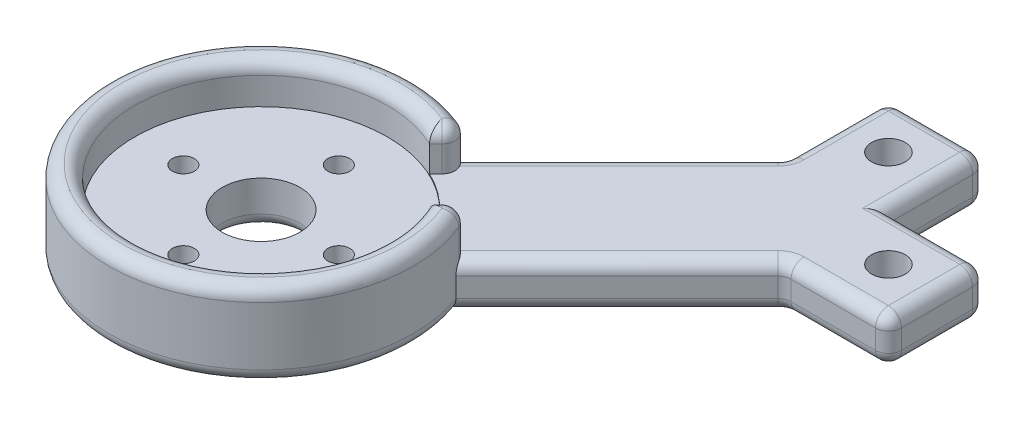
from build123d import *

# Parameters (mm, degrees)
SKETCH1_W           = 15
SKETCH1_H           = 15
BOSS_EXTRUDE1_DEPTH = 3.5
SKETCH2_W           = 7.5
SKETCH2_H           = 7.5
CUT_EXTRUDE1_DEPTH  = 22.5
SKETCH3_R           = 1.3
CUT_EXTRUDE2_DEPTH  = 22.5
BOSS_EXTRUDE3_DEPTH = 3.5
SKETCH7_R           = 11.75
BOSS_EXTRUDE4_DEPTH = 3.5
BOSS_EXTRUDE5_START = 3
SKETCH8_R           = 11.75
BOSS_EXTRUDE5_DEPTH = 3
SKETCH9_R           = 9.75
CUT_EXTRUDE3_DEPTH  = 3.1
FILLET8_R           = 1
FILLET9_R           = 1
SKETCH12_R          = 3
CUT_EXTRUDE6_DEPTH  = 41.393441406
FILLET23_R          = 1
FILLET24_R          = 1
FILLET25_R          = 1
CUT_EXTRUDE7_DEPTH  = 41.401981494
FILLET31_R          = 1
FILLET32_R          = 1
SKETCH30_R          = 0.85
CUT_EXTRUDE8_DEPTH  = 3.5
FILLET33_R          = 1


with BuildPart() as part:
    # Sketch1 → Boss-Extrude1 (new body)
    with BuildSketch(Plane(origin=(0, 0, 0), x_dir=(1, 0, 0), z_dir=(0, 1, 0))):
        with Locations((7.5, 7.5)):
            Rectangle(SKETCH1_W, SKETCH1_H)
    extrude(amount=BOSS_EXTRUDE1_DEPTH)

    # Sketch2 → Cut-Extrude1 (cut, through all)
    with BuildSketch(Plane(origin=(0, 3.5, 0), x_dir=(1, 0, 0), z_dir=(0, 1, 0))):
        with Locations((11.25, 11.25)):
            Rectangle(SKETCH2_W, SKETCH2_H)
    extrude(amount=-CUT_EXTRUDE1_DEPTH, mode=Mode.SUBTRACT)

    # Sketch3 → Cut-Extrude2 (cut, through all)
    with BuildSketch(Plane(origin=(0, 3.5, 0), x_dir=(1, 0, 0), z_dir=(0, 1, 0))):
        with Locations(Location((3.75, 11.25, 0), (0, 0, 270))):
            Circle(SKETCH3_R)
    cut_extrude2 = extrude(amount=-CUT_EXTRUDE2_DEPTH, mode=Mode.SUBTRACT)

    # Mirror1: Cut-Extrude2 across plane
    add(cut_extrude2.mirror(Plane(origin=(0, 0, 0), x_dir=(-0.7071067811865475, 0, 0.7071067811865476), z_dir=(0.7071067811865478, 0, 0.7071067811865474))), mode=Mode.SUBTRACT)

    # Sketch6 → Boss-Extrude3 (add)
    with BuildSketch(Plane(origin=(0, 3.5, 0), x_dir=(1, 0, 0), z_dir=(0, 1, 0))):
        Polygon((0, 7.071067812), (-12.727922061, -5.656854249), (-5.656854249, -12.727922061), (7.071067812, 0), align=None)
    extrude(amount=-BOSS_EXTRUDE3_DEPTH)

    # Sketch7 → Boss-Extrude4 (add)
    with BuildSketch(Plane(origin=(0, 3.5, 0), x_dir=(1, 0, 0), z_dir=(0, 1, 0))):
        with Locations((-16.711114776, -16.711114776)):
            Circle(SKETCH7_R)
    extrude(amount=-BOSS_EXTRUDE4_DEPTH)

    # Sketch8 → Boss-Extrude5 (add)
    with BuildSketch(Plane(origin=(0, 3.5, 0), x_dir=(1, 0, 0), z_dir=(0, 1, 0)).offset(BOSS_EXTRUDE5_START)):
        with Locations(Location((-16.711114776, -16.711114776, 0), (0, 0, 270))):
            Circle(SKETCH8_R)
    extrude(amount=-BOSS_EXTRUDE5_DEPTH)

    # Sketch9 → Cut-Extrude3 (cut)
    with BuildSketch(Plane(origin=(0, 6.5, 0), x_dir=(1, 0, 0), z_dir=(0, 1, 0))):
        with Locations(Location((-16.711114776, -16.711114776, 0), (0, 0, 270))):
            Circle(SKETCH9_R)
    extrude(amount=-CUT_EXTRUDE3_DEPTH, mode=Mode.SUBTRACT)

    # Fillet8
    fillet8_edges = [part.edges().sort_by_distance(p)[0] for p in [
        (15, 0, -3.75),
    ]]
    fillet(fillet8_edges, radius=FILLET8_R)

    # Fillet9
    fillet9_edges = [part.edges().sort_by_distance(p)[0] for p in [
        (3.75, 0, -15),
    ]]
    fillet(fillet9_edges, radius=FILLET9_R)

    # Sketch12 → Cut-Extrude6 (cut, through all)
    with BuildSketch(Plane(origin=(0, 3.4, 0), x_dir=(1, 0, 0), z_dir=(0, 1, 0))):
        with Locations(Location((-16.711114776, -16.711114776, 0), (0, 0, 270))):
            Circle(SKETCH12_R)
    extrude(amount=-CUT_EXTRUDE6_DEPTH, mode=Mode.SUBTRACT)

    # Fillet23
    fillet23_edges = [part.edges().sort_by_distance(p)[0] for p in [
        (7.5, 2.25, -15),
        (7.5, 0, -10.75),
        (7.5, 0.292893219, -14.707106781),
    ]]
    fillet(fillet23_edges, radius=FILLET23_R)

    # Fillet24
    fillet24_edges = [part.edges().sort_by_distance(p)[0] for p in [
        (10.25, 0, -7.5),
        (15, 2.25, -7.5),
        (14.707106781, 0.292893219, -7.5),
    ]]
    fillet(fillet24_edges, radius=FILLET24_R)

    # Fillet25
    fillet25_edges = [part.edges().sort_by_distance(p)[0] for p in [
        (14.707106781, 3.5, -7.207106781),
        (15, 3.5, -3.25),
        (10.75, 3.5, -7.5),
    ]]
    fillet(fillet25_edges, radius=FILLET25_R)

    # Sketch27 → Cut-Extrude7 (cut, through all)
    with BuildSketch(Plane(origin=(0, 3.5, 0), x_dir=(1, 0, 0), z_dir=(0, 1, 0))):
        Polygon((-8.402610097, -3.80641602), (-3.80641602, -8.402610097), (-10.877483832, -15.473677909), (-15.473677909, -10.877483831), align=None)
    extrude(amount=CUT_EXTRUDE7_DEPTH, mode=Mode.SUBTRACT)

    # Fillet31
    fillet31_edges = [part.edges().sort_by_distance(p)[0] for p in [
        (3.25, 3.5, -15),
        (7.207106781, 3.5, -14.707106781),
        (7.5, 3.5, -10.25),
    ]]
    fillet(fillet31_edges, radius=FILLET31_R)

    # Fillet32
    fillet32_edges = [part.edges().sort_by_distance(p)[0] for p in [
        (-26.220161682, 6.5, 14.556926545),
        (-25.019619455, 6.5, 25.019619455),
        (-11.024852104, 5, 6.428658026),
        (-6.428658026, 5, 11.024852104),
        (-7.170837882, 6.5, 11.767031959),
        (-11.767031959, 6.5, 7.170837882),
    ]]
    fillet(fillet32_edges, radius=FILLET32_R - 0.0001)  # a hair under: the kernel refuses the full size

    # Sketch30 → Cut-Extrude8 (cut)
    with BuildSketch(Plane(origin=(0, 3.4, 0), x_dir=(1, 0, 0), z_dir=(0, 1, 0))):
        with Locations(Location((-16.711114776, -10.711114776, 0), (0, 0, 270))):
            Circle(SKETCH30_R)
        with Locations(Location((-10.711114776, -16.711114776, 0), (0, 0, 270))):
            Circle(SKETCH30_R)
        with Locations(Location((-16.711114776, -22.711114776, 0), (0, 0, 270))):
            Circle(SKETCH30_R)
        with Locations(Location((-22.711114776, -16.711114776, 0), (0, 0, 270))):
            Circle(SKETCH30_R)
    extrude(amount=-CUT_EXTRUDE8_DEPTH, mode=Mode.SUBTRACT)

    # Fillet33
    fillet33_edges = [part.edges().sort_by_distance(p)[0] for p in [
        (-6.363961031, 3.5, -0.707106781),
        (-6.363961031, 0, -0.707106781),
        (0, 3.5, -10.535533906),
        (0, 3.207106781, -14.707106781),
        (0, 1.75, -15),
        (0, 0.292893219, -14.707106781),
        (14.707106781, 0.292893219, 0),
        (15, 1.75, 0),
        (14.707106781, 3.207106781, 0),
        (3.75, 0, -12.55),
        (12.55, 0, -3.75),
        (0, 0, -10.535533906),
        (-25.019619455, 0, 25.019619455),
        (10.535533906, 0, 0),
        (-16.711114776, 0, 13.711114776),
        (0, 1.75, -7.071067812),
        (7.071067812, 1.75, 0),
        (0.707106781, 3.5, 6.363961031),
        (0.707106781, 0, 6.363961031),
        (10.535533906, 3.5, 0),
        (-22.711114776, 0, 15.861114776),
        (-16.711114776, 0, 21.861114776),
        (-10.711114776, 0, 15.861114776),
        (-16.711114776, 0, 9.861114776),
    ]]
    fillet(fillet33_edges, radius=FILLET33_R)


solid = part.part
